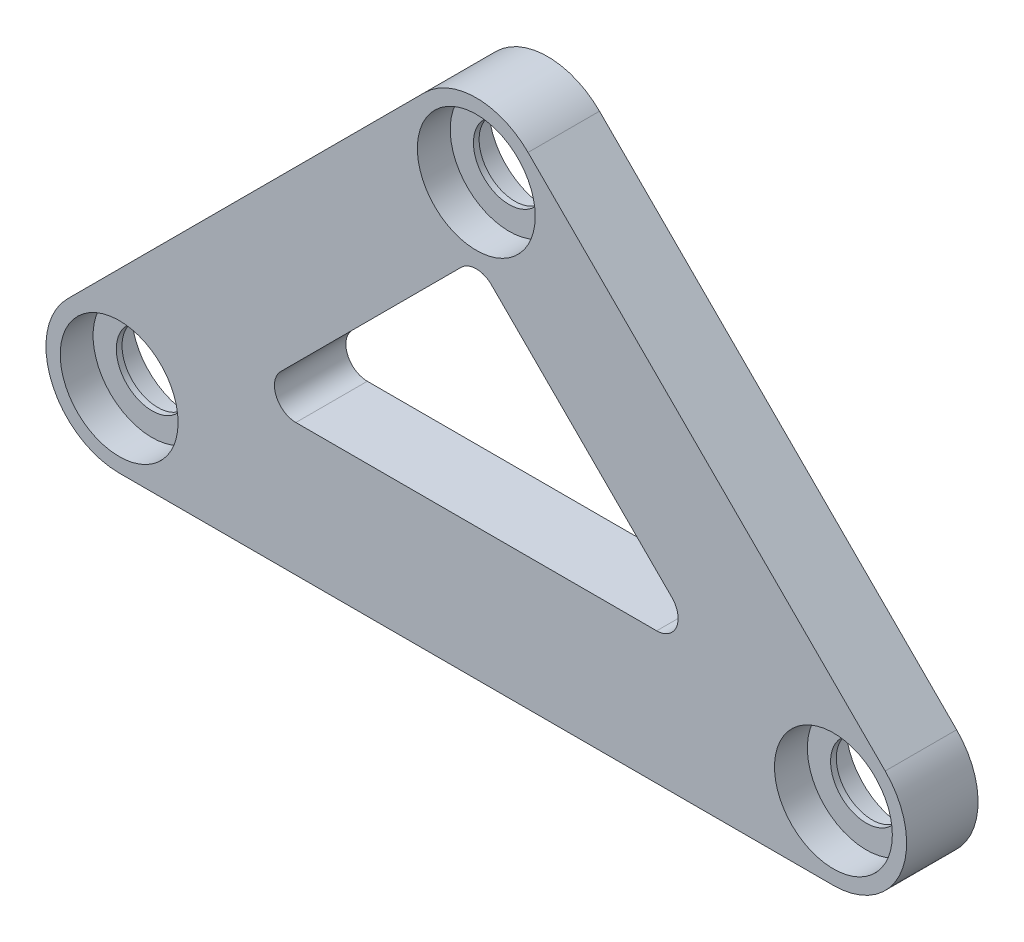
from build123d import *

# Parameters (mm, degrees)
BOSS_EXTRUDE4_DEPTH = 10
SKETCH3_R           = 8.25
CUT_EXTRUDE1_DEPTH  = 4.6
CUT_EXTRUDE2_START  = -4.6
SKETCH4_R           = 8.25
CUT_EXTRUDE2_DEPTH  = 4.6
CUT_EXTRUDE3_DEPTH  = 16.6
SKETCH6_R           = 5
CUT_EXTRUDE4_DEPTH  = 16.6
FILLET1_R           = 3


with BuildPart() as part:
    # Sketch2 → Boss-Extrude4 (new body)
    with BuildSketch(Plane.XY):
        with BuildLine():
            Line((-57.247844507, 57.247844507), (-107.247844507, 7.247844507))
            ThreePointArc((-107.247844507, 7.247844507), (-109.469765208, -3.922505182), (-100, -10.25))
            Line((-100, -10.25), (0, -10.25))
            ThreePointArc((0, -10.25), (9.469765208, -3.922505182), (7.247844507, 7.247844507))
            Line((7.247844507, 7.247844507), (-42.752155493, 57.247844507))
            ThreePointArc((-42.752155493, 57.247844507), (-50, 60.25), (-57.247844507, 57.247844507))
        make_face()
        Polygon((-75.254310986, 10.25), (-50, 35.504310986), (-24.745689014, 10.25), align=None, mode=Mode.SUBTRACT)
    extrude(amount=BOSS_EXTRUDE4_DEPTH)

    # Sketch3 → Cut-Extrude1 (cut)
    with BuildSketch(Plane(origin=(0, 0, 0), x_dir=(-1, 0, 0), z_dir=(0, 0, -1))):
        Circle(SKETCH3_R)
        with Locations((50, 50)):
            Circle(SKETCH3_R)
        with Locations((100, 0)):
            Circle(SKETCH3_R)
    extrude(amount=-CUT_EXTRUDE1_DEPTH, mode=Mode.SUBTRACT)

    # Sketch4 → Cut-Extrude2 (cut)
    with BuildSketch(Plane.XY.offset(10).offset(CUT_EXTRUDE2_START)):
        with Locations((-100, 0)):
            Circle(SKETCH4_R)
        with Locations((-50, 50)):
            Circle(SKETCH4_R)
        Circle(SKETCH4_R)
    extrude(amount=CUT_EXTRUDE2_DEPTH, mode=Mode.SUBTRACT)

    # Sketch5 → Cut-Extrude3 (cut)
    with BuildSketch(Plane(origin=(0, 0, 0), x_dir=(-1, 0, 0), z_dir=(0, 0, -1))):
        Polygon((17.5, 8.25), (50, 40.75), (82.5, 8.25), align=None)
    extrude(amount=-CUT_EXTRUDE3_DEPTH, mode=Mode.SUBTRACT)

    # Sketch6 → Cut-Extrude4 (cut)
    with BuildSketch(Plane.XY.offset(10)):
        with Locations((-100, 0)):
            Circle(SKETCH6_R)
        with Locations((-50, 50)):
            Circle(SKETCH6_R)
        Circle(SKETCH6_R)
    extrude(amount=-CUT_EXTRUDE4_DEPTH, mode=Mode.SUBTRACT)

    # Fillet1
    fillet1_edges = [part.edges().sort_by_distance(p)[0] for p in [
        (-82.5, 8.25, 5),
        (-17.5, 8.25, 5),
        (-50, 40.75, 5),
    ]]
    fillet(fillet1_edges, radius=FILLET1_R)


solid = part.part
